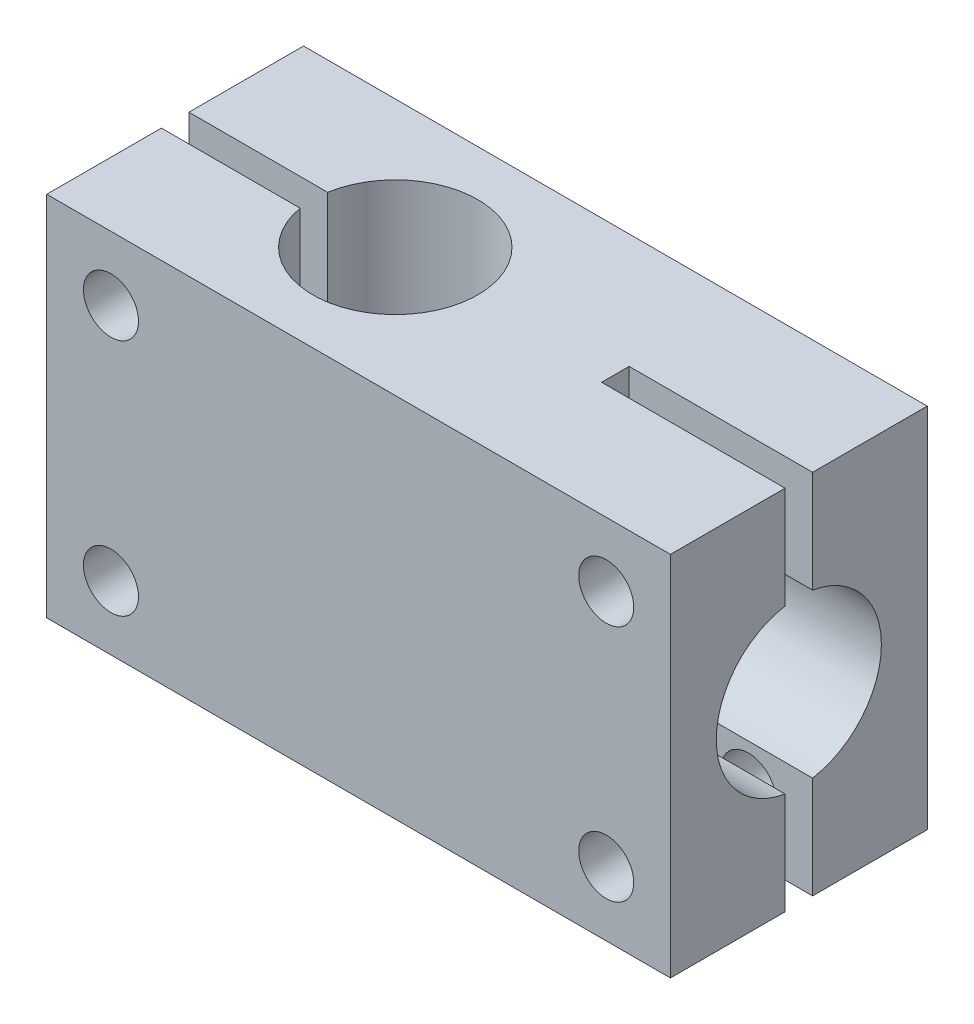
from build123d import *

# Parameters (mm, degrees)
SKETCH1_W           = 34
SKETCH1_H           = 14
BOSS_EXTRUDE2_DEPTH = 20
CUT_EXTRUDE1_DEPTH  = 30.748949561
CUT_EXTRUDE2_DEPTH  = 10
SKETCH5_R           = 1.5
CUT_EXTRUDE4_DEPTH  = 30.748949561


with BuildPart() as part:
    # Sketch1 → Boss-Extrude2 (new body)
    with BuildSketch(Plane(origin=(0, 0, 0), x_dir=(1, 0, 0), z_dir=(0, 1, 0))):
        with Locations((0, 7)):
            Rectangle(SKETCH1_W, SKETCH1_H)
    extrude(amount=BOSS_EXTRUDE2_DEPTH)

    # Sketch3 → Cut-Extrude1 (cut, through all)
    with BuildSketch(Plane(origin=(0, 20, 0), x_dir=(1, 0, 0), z_dir=(0, 1, 0))):
        with BuildLine():
            Line((-17, 7.75), (-17, 6.25))
            Line((-17, 6.25), (-9.437059837, 6.25))
            ThreePointArc((-9.437059837, 6.25), (-0.5, 7), (-9.437059837, 7.75))
            Line((-9.437059837, 7.75), (-17, 7.75))
        make_face()
    extrude(amount=-CUT_EXTRUDE1_DEPTH, mode=Mode.SUBTRACT)

    # Sketch4 → Cut-Extrude2 (cut)
    with BuildSketch(Plane(origin=(17, 0, 0), x_dir=(0, 0, -1), z_dir=(1, 0, 0))):
        with BuildLine():
            Line((6.24904163, 20), (6.24904163, 14.437059837))
            ThreePointArc((6.24904163, 14.437059837), (2.49904163, 10), (6.24904163, 5.562940163))
            Line((6.24904163, 5.562940163), (6.24904163, 0))
            Line((6.24904163, 0), (7.74904163, 0))
            Line((7.74904163, 0), (7.74904163, 5.562940163))
            ThreePointArc((7.74904163, 5.562940163), (11.49904163, 10), (7.74904163, 14.437059837))
            Line((7.74904163, 14.437059837), (7.74904163, 20))
            Line((7.74904163, 20), (6.24904163, 20))
        make_face()
    extrude(amount=-CUT_EXTRUDE2_DEPTH, mode=Mode.SUBTRACT)

    # Sketch5 → Cut-Extrude4 (cut, through all)
    with BuildSketch(Plane.XY):
        with Locations((-13.5, 16.5)):
            Circle(SKETCH5_R)
        with Locations((-13.5, 3.5)):
            Circle(SKETCH5_R)
        with Locations((13.5, 16.5)):
            Circle(SKETCH5_R)
        with Locations((13.5, 3.5)):
            Circle(SKETCH5_R)
    extrude(amount=-CUT_EXTRUDE4_DEPTH, mode=Mode.SUBTRACT)


solid = part.part
